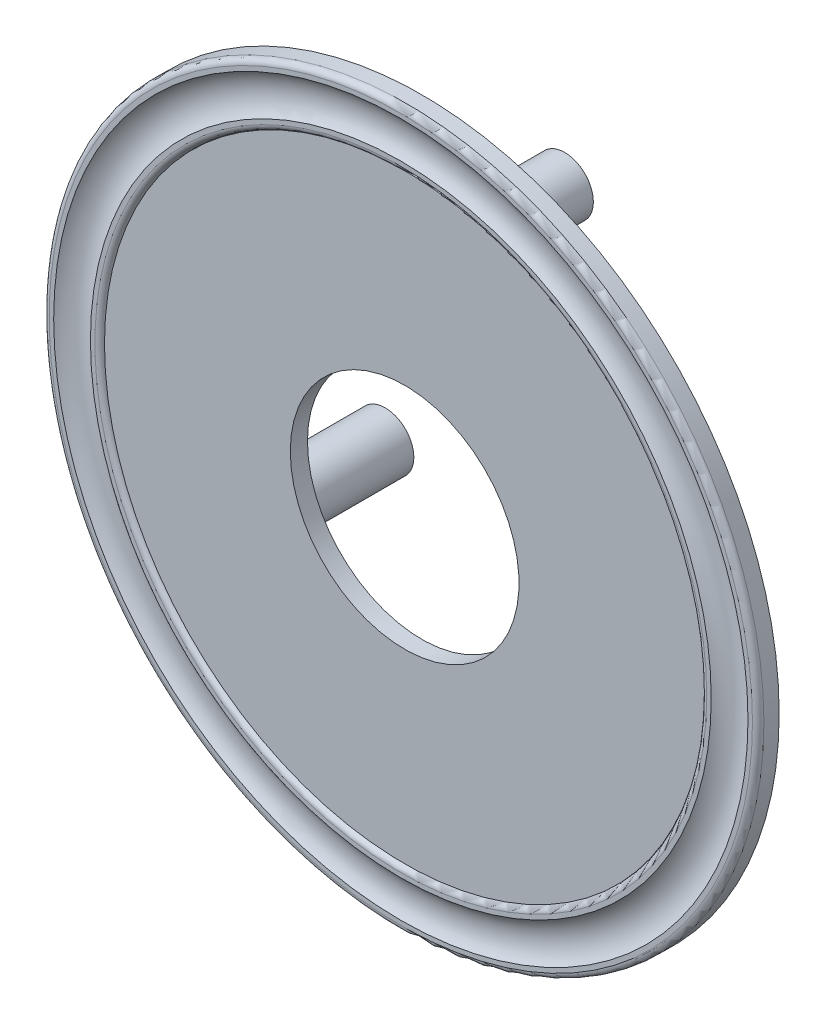
from build123d import *

# Parameters (mm, degrees)
EXTRUDE_START   = -6
SKETCH_7_R      = 105
SKETCH_7_R_2    = 40
EXTRUDE_1_DEPTH = 6
SKETCH_8_R      = 10
EXTRUDE_2_DEPTH = 50


with BuildPart() as part:
    # 草圖3 → 旋轉2 (revolve)
    with BuildSketch(Plane(origin=(0, 0, 0), x_dir=(1, 0, 0), z_dir=(0, 1, 0))):
        with BuildLine():
            Line((-10, 15), (10, 15))
            Line((10, 15), (10, 9.660444431))
            ThreePointArc((10, 9.660444431), (9.414213562, 8.246230869), (8, 7.660444431))
            Line((8, 7.660444431), (6.427876097, 7.660444431))
            ThreePointArc((6.427876097, 7.660444431), (0, 10), (-6.427876097, 7.660444431))
            Line((-6.427876097, 7.660444431), (-8, 7.660444431))
            ThreePointArc((-8, 7.660444431), (-9.414213562, 8.246230869), (-10, 9.660444431))
            Line((-10, 9.660444431), (-10, 15))
        make_face()
    revolve(axis=Axis((115, 0, 57.074015866), (0, 0, -1)))

    # 草圖7 → 填料-伸長1 (add)
    with BuildSketch(Plane(origin=(0, 0, -15), x_dir=(-1, 0, 0), z_dir=(0, 0, -1)).offset(EXTRUDE_START)):
        with Locations((-115, 0)):
            Circle(SKETCH_7_R)
        with Locations((-115, 0)):
            Circle(SKETCH_7_R_2, mode=Mode.SUBTRACT)
    extrude(amount=EXTRUDE_1_DEPTH)

    # 草圖8 → 填料-伸長2 (add)
    with BuildSketch(Plane(origin=(0, 0, -15), x_dir=(-1, 0, 0), z_dir=(0, 0, -1))):
        with Locations((-115, 72.5)):
            Circle(SKETCH_8_R)
        with Locations((-52.213158226, -36.25)):
            Circle(SKETCH_8_R)
        with Locations((-177.786841774, -36.25)):
            Circle(SKETCH_8_R)
    extrude(amount=EXTRUDE_2_DEPTH)


solid = part.part
